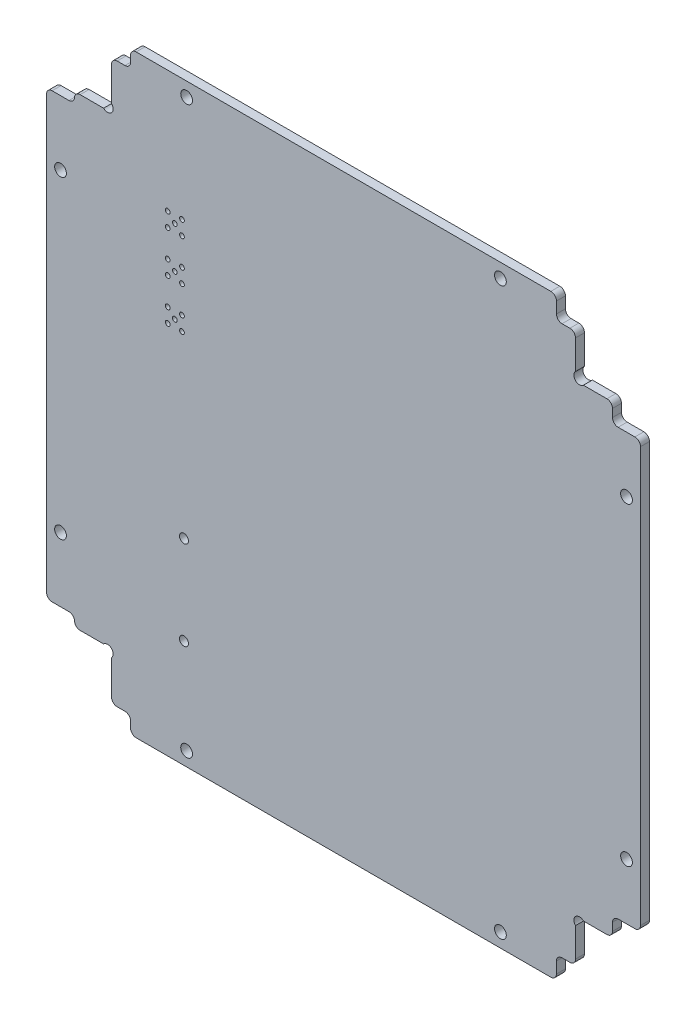
from build123d import *

# Parameters (mm, degrees)
SKETCH1_W            = 106
SKETCH1_H            = 106
MAINOUTLINE_DEPTH    = 1.6
RAILCUTOUTS_DEPTH    = 75.970394157
DOGBONES_DEPTH       = 75.970394157
SOLARFILLETS_DEPTH   = 75.970394157
HANDLINGFILLETS_R    = 1
SKETCH7_R            = 0.8
SKETCH7_R_2          = 0.425
CONNECTORHOLES_DEPTH = 75.9703943
M2_CLEARANCE_HOLE1_D = 2.1


with BuildPart() as part:
    # Sketch1 → mainOutline (new body)
    with BuildSketch(Plane.XY):
        Rectangle(SKETCH1_W, SKETCH1_H)
    extrude(amount=MAINOUTLINE_DEPTH)

    # Sketch4 → railCutouts (cut, through all)
    with BuildSketch(Plane(origin=(0, 0, 0), x_dir=(-1, 0, 0), z_dir=(0, 0, -1))):
        Polygon((-41.4, -41.4), (-48, -41.4), (-48, -39), (-49.9975, -39), (-60.106513243, -39), (-60.106513243, -61.452099286), (-39, -61.452099286), (-39, -49.9), (-39, -49), (-41.4, -49), align=None)
        Polygon((39, -56.27525328), (39, -49.9), (41.4, -49.9), (41.4, -41.4), (48, -41.4), (48, -40.5), (55.517672261, -40.5), (55.517672261, -56.27525328), align=None)
        Polygon((55.383846757, 40.5), (48, 40.5), (48, 41.4), (41.4, 41.4), (41.4, 49.9), (39, 49.9), (39, 57.687687567), (55.383846757, 57.687687567), align=None)
        Polygon((-39, 59.880423019), (-39, 49.9), (-39, 49), (-41.4, 49), (-41.4, 41.4), (-48, 41.4), (-48, 39), (-49.9975, 39), (-56.842822937, 39), (-56.842822937, 59.880423019), align=None)
    extrude(amount=-RAILCUTOUTS_DEPTH, mode=Mode.SUBTRACT)

    # Sketch5 → dogbones (cut, through all)
    with BuildSketch(Plane(origin=(0, 0, 0), x_dir=(-1, 0, 0), z_dir=(0, 0, -1))):
        with BuildLine():
            Line((-41.4, -42.814213562), (-44.73741596, -46.151629522))
            ThreePointArc((-44.73741596, -46.151629522), (-46.151629522, -46.151629522), (-46.151629522, -44.73741596))
            Line((-46.151629522, -44.73741596), (-42.814213562, -41.4))
            ThreePointArc((-42.814213562, -41.4), (-41.4, -41.4), (-41.4, -42.814213562))
        make_face()
        with BuildLine():
            Line((42.814213562, -41.4), (44.747298889, -43.333085326))
            ThreePointArc((44.747298889, -43.333085326), (44.747298889, -44.747298889), (43.333085326, -44.747298889))
            Line((43.333085326, -44.747298889), (41.4, -42.814213562))
            ThreePointArc((41.4, -42.814213562), (41.4, -41.4), (42.814213562, -41.4))
        make_face()
        with BuildLine():
            Line((41.4, 42.814213562), (43.321909081, 44.736122643))
            ThreePointArc((43.321909081, 44.736122643), (44.736122643, 44.736122643), (44.736122643, 43.321909081))
            Line((44.736122643, 43.321909081), (42.814213562, 41.4))
            ThreePointArc((42.814213562, 41.4), (41.4, 41.4), (41.4, 42.814213562))
        make_face()
        with BuildLine():
            Line((-42.814213562, 41.4), (-44.503927418, 43.089713856))
            ThreePointArc((-44.503927418, 43.089713856), (-44.503927418, 44.503927418), (-43.089713856, 44.503927418))
            Line((-43.089713856, 44.503927418), (-41.4, 42.814213562))
            ThreePointArc((-41.4, 42.814213562), (-41.4, 41.4), (-42.814213562, 41.4))
        make_face()
    extrude(amount=-DOGBONES_DEPTH, mode=Mode.SUBTRACT)

    # Sketch6 → solarFillets (cut, through all)
    with BuildSketch(Plane(origin=(0, 0, 0), x_dir=(-1, 0, 0), z_dir=(0, 0, -1))):
        with BuildLine():
            Line((-40, 50), (-40, 53))
            ThreePointArc((-40, 53), (-39, 54), (-38, 53))
            Line((-38, 53), (-38, 50))
            ThreePointArc((-38, 50), (-39, 49), (-40, 50))
        make_face()
        with BuildLine():
            Line((-49, 38), (-53, 38))
            ThreePointArc((-53, 38), (-54, 39), (-53, 40))
            Line((-53, 40), (-49, 40))
            ThreePointArc((-49, 40), (-48, 39), (-49, 38))
        make_face()
        with BuildLine():
            Line((-49, -40), (-55.214202913, -40))
            ThreePointArc((-55.214202913, -40), (-56.214202913, -39), (-55.214202913, -38))
            Line((-55.214202913, -38), (-49, -38))
            ThreePointArc((-49, -38), (-48, -39), (-49, -40))
        make_face()
        with BuildLine():
            Line((-38, -50), (-38, -53.916094318))
            ThreePointArc((-38, -53.916094318), (-39, -54.916094318), (-40, -53.916094318))
            Line((-40, -53.916094318), (-40, -50))
            ThreePointArc((-40, -50), (-39, -49), (-38, -50))
        make_face()
        with BuildLine():
            Line((40, -50.9), (40, -54.538013421))
            ThreePointArc((40, -54.538013421), (39, -55.538013421), (38, -54.538013421))
            Line((38, -54.538013421), (38, -50.9))
            ThreePointArc((38, -50.9), (39, -49.9), (40, -50.9))
        make_face()
        with BuildLine():
            Line((49, -39.5), (54.202622605, -39.5))
            ThreePointArc((54.202622605, -39.5), (55.202622605, -40.5), (54.202622605, -41.5))
            Line((54.202622605, -41.5), (49, -41.5))
            ThreePointArc((49, -41.5), (48, -40.5), (49, -39.5))
        make_face()
        with BuildLine():
            Line((49, 41.5), (54.556563772, 41.5))
            ThreePointArc((54.556563772, 41.5), (55.556563772, 40.5), (54.556563772, 39.5))
            Line((54.556563772, 39.5), (49, 39.5))
            ThreePointArc((49, 39.5), (48, 40.5), (49, 41.5))
        make_face()
        with BuildLine():
            Line((38, 50.9), (38, 55.828092709))
            ThreePointArc((38, 55.828092709), (39, 56.828092709), (40, 55.828092709))
            Line((40, 55.828092709), (40, 50.9))
            ThreePointArc((40, 50.9), (39, 49.9), (38, 50.9))
        make_face()
    extrude(amount=-SOLARFILLETS_DEPTH, mode=Mode.SUBTRACT)

    # handlingFillets
    handlingfillets_edges = [part.edges().sort_by_distance(p)[0] for p in [
        (-41.4, -49.9, 0.8),
        (-38, -53, 0.8),
        (-53, -39.5, 0.8),
        (-48, -41.4, 0.8),
        (-48, 41.4, 0.8),
        (-53, 39.5, 0.8),
        (-41.4, 49.9, 0.8),
        (-38, 53, 0.8),
        (38, 53, 0.8),
        (41.4, 49, 0.8),
        (48, 41.4, 0.8),
        (53, 38, 0.8),
        (53, -38, 0.8),
        (48, -41.4, 0.8),
        (41.4, -49, 0.8),
        (38, -53, 0.8),
    ]]
    fillet(handlingfillets_edges, radius=HANDLINGFILLETS_R)

    # Sketch7 → connectorHoles (cut, through all)
    with BuildSketch(Plane.XY.offset(1.6)):
        with Locations((-28.472296419, -17.925)):
            Circle(SKETCH7_R)
        with Locations((-28.472296419, -33.775)):
            Circle(SKETCH7_R)
        with Locations((-31.37, 28.67)):
            Circle(SKETCH7_R_2)
        with Locations((-28.83, 28.67)):
            Circle(SKETCH7_R_2)
        with Locations((-30.1, 29.94)):
            Circle(SKETCH7_R_2)
        with Locations((-28.83, 31.21)):
            Circle(SKETCH7_R_2)
        with Locations((-31.37, 31.21)):
            Circle(SKETCH7_R_2)
        with Locations((-31.37, 21.27)):
            Circle(SKETCH7_R_2)
        with Locations((-28.83, 21.27)):
            Circle(SKETCH7_R_2)
        with Locations((-30.1, 22.54)):
            Circle(SKETCH7_R_2)
        with Locations((-28.83, 23.81)):
            Circle(SKETCH7_R_2)
        with Locations((-31.37, 23.81)):
            Circle(SKETCH7_R_2)
        with Locations((-31.37, 13.87)):
            Circle(SKETCH7_R_2)
        with Locations((-28.83, 13.87)):
            Circle(SKETCH7_R_2)
        with Locations((-30.1, 15.14)):
            Circle(SKETCH7_R_2)
        with Locations((-28.83, 16.41)):
            Circle(SKETCH7_R_2)
        with Locations((-31.37, 16.41)):
            Circle(SKETCH7_R_2)
    extrude(amount=-CONNECTORHOLES_DEPTH, mode=Mode.SUBTRACT)

    # M2 Clearance Hole1 (through all)
    with Locations(Plane(origin=(0, 0, 0), x_dir=(-1, 0, 0), z_dir=(0, 0, -1))):
        with Locations((50.5, -28), (28, -50.5), (-50.5, -28), (-28, -50.5), (-28, 50.5), (-50.5, 28), (28, 50.5), (50.5, 28)):
            Hole(M2_CLEARANCE_HOLE1_D / 2)


solid = part.part
